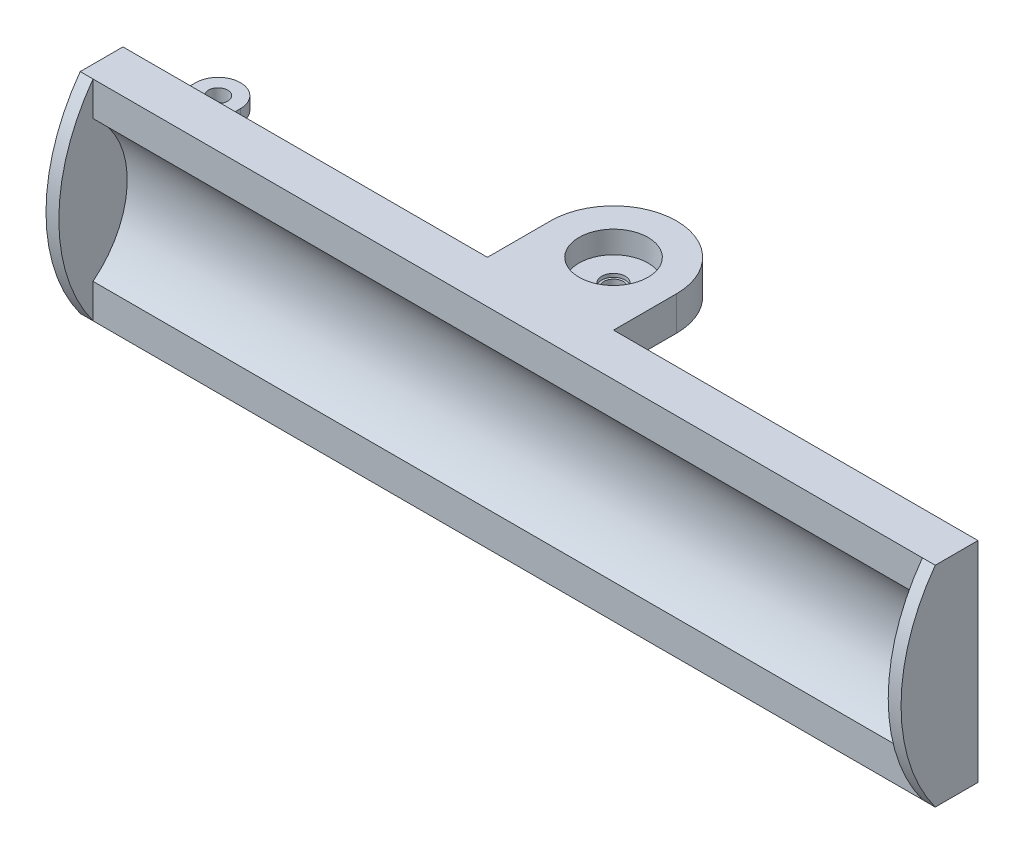
from build123d import *

# Parameters (mm, degrees)
BOSS_EXTRUDE1_DEPTH = 100
SKETCH3_R           = 2.75
BOSS_EXTRUDE2_DEPTH = 8
SKETCH4_R           = 8.075
SKETCH4_R_2         = 2.75
CUT_EXTRUDE1_DEPTH  = 5.2
BOSS_EXTRUDE4_START = -2
SKETCH5_R           = 2.75
SKETCH5_R_2         = 2.25
BOSS_EXTRUDE4_DEPTH = 2
BOSS_EXTRUDE5_START = 8
BOSS_EXTRUDE5_DEPTH = 3
BOSS_EXTRUDE6_DEPTH = 3


with BuildPart() as part:
    # Sketch1 → Boss-Extrude1 (new, symmetric)
    with BuildSketch(Plane.YZ):
        with BuildLine():
            Line((-24.5, 5), (-24.5, -5))
            Line((-24.5, -5), (24.5, -5))
            Line((24.5, -5), (24.5, 5))
            Line((24.5, 5), (16.492422502, 5))
            ThreePointArc((16.492422502, 5), (0, -3), (-16.492422502, 5))
            Line((-16.492422502, 5), (-24.5, 5))
        make_face()
    extrude(amount=BOSS_EXTRUDE1_DEPTH, both=True)

    # Sketch3 → Boss-Extrude2 (add)
    with BuildSketch(Plane.XZ.offset(24.5)):
        with BuildLine():
            ThreePointArc((-14.75, -19.75), (0, -34.5), (14.75, -19.75))
            Line((14.75, -19.75), (14.75, -5))
            Line((14.75, -5), (-14.75, -5))
            Line((-14.75, -5), (-14.75, -19.75))
        make_face()
        with Locations((0, -19.75)):
            Circle(SKETCH3_R, mode=Mode.SUBTRACT)
    boss_extrude2 = extrude(amount=-BOSS_EXTRUDE2_DEPTH)

    # Sketch4 → Cut-Extrude1 (cut)
    with BuildSketch(Plane(origin=(0, -24.5, 0), x_dir=(-1, 0, 0), z_dir=(0, -1, 0))):
        with Locations((0, 19.75)):
            Circle(SKETCH4_R)
        with Locations((0, 19.75)):
            Circle(SKETCH4_R_2, mode=Mode.SUBTRACT)
    cut_extrude1 = extrude(amount=-CUT_EXTRUDE1_DEPTH, mode=Mode.SUBTRACT)

    # Sketch5 → Boss-Extrude4 (add)
    with BuildSketch(Plane(origin=(0, -16.5, 0), x_dir=(-1, 0, 0), z_dir=(0, 1, 0)).offset(BOSS_EXTRUDE4_START)):
        with Locations((0, -19.75)):
            Circle(SKETCH5_R)
        with Locations((0, -19.75)):
            Circle(SKETCH5_R_2, mode=Mode.SUBTRACT)
    boss_extrude4 = extrude(amount=BOSS_EXTRUDE4_DEPTH)

    # Mirror1: Boss-Extrude2, Cut-Extrude1, Boss-Extrude4 across plane
    add(boss_extrude2.mirror(Plane(origin=(0, 0, 0), x_dir=(0, 0, 1), z_dir=(0, -1, 0))))
    add(cut_extrude1.mirror(Plane(origin=(0, 0, 0), x_dir=(0, 0, 1), z_dir=(0, -1, 0))), mode=Mode.SUBTRACT)
    add(boss_extrude4.mirror(Plane(origin=(0, 0, 0), x_dir=(0, 0, 1), z_dir=(0, -1, 0))))

    # Sketch6 → Boss-Extrude5 (add)
    with BuildSketch(Plane(origin=(0, 0, 0), x_dir=(-1, 0, 0), z_dir=(0, -1, 0)).offset(BOSS_EXTRUDE5_START)):
        with BuildLine():
            ThreePointArc((97.75, 19.75), (92.5, 25), (87.25, 19.75))
            Line((87.25, 19.75), (87.25, 5))
            Line((87.25, 5), (97.75, 5))
            Line((97.75, 5), (97.75, 19.75))
        make_face()
        with BuildLine():
            ThreePointArc((94.75, 19.75), (92.5, 17.5), (90.25, 19.75))
            ThreePointArc((90.25, 19.75), (92.5, 22), (94.75, 19.75))
        make_face(mode=Mode.SUBTRACT)
    boss_extrude5 = extrude(amount=BOSS_EXTRUDE5_DEPTH)

    # Mirror2: Boss-Extrude5 across plane
    add(boss_extrude5.mirror(Plane(origin=(0, 0, 0), x_dir=(0, 0, 1), z_dir=(0, -1, 0))))

    # Sketch7 → Boss-Extrude6 (add)
    with BuildSketch(Plane(origin=(-100, 0, 0), x_dir=(0, -1, 0), z_dir=(-1, 0, 0))):
        with BuildLine():
            ThreePointArc((24.5, 5), (0, 13), (-24.5, 5))
            Line((-24.5, 5), (-24.5, -5))
            Line((-24.5, -5), (24.5, -5))
            Line((24.5, -5), (24.5, 5))
        make_face()
    boss_extrude6 = extrude(amount=-BOSS_EXTRUDE6_DEPTH)

    # Mirror3: Boss-Extrude6 across plane
    add(boss_extrude6.mirror(Plane(origin=(0, 0, 0), x_dir=(0, 0, 1), z_dir=(1, 0, 0))))


solid = part.part
